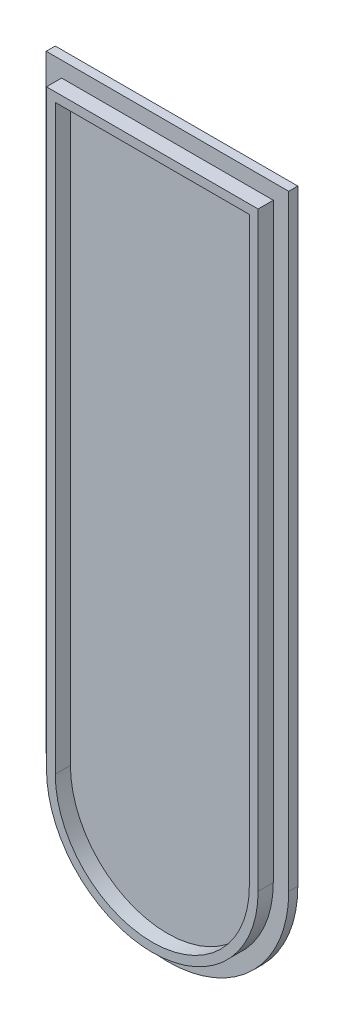
from build123d import *

# Parameters (mm, degrees)
RESSALTO_EXTRUS_O1_DEPTH = 3
RESSALTO_EXTRUS_O2_DEPTH = 5


with BuildPart() as part:
    # Esboço1 → Ressalto-extrusão1 (new body)
    with BuildSketch(Plane.XY):
        with BuildLine():
            Line((-40, 0), (-40, 200))
            Line((-40, 200), (40, 200))
            Line((40, 200), (40, 0))
            ThreePointArc((40, 0), (0, -40), (-40, 0))
        make_face()
    extrude(amount=RESSALTO_EXTRUS_O1_DEPTH)

    # Esboço2 → Ressalto-extrusão2 (add)
    with BuildSketch(Plane.XY.offset(3)):
        with BuildLine():
            Line((-34.9, 0), (-34.9, 194.9))
            Line((-34.9, 194.9), (34.9, 194.9))
            Line((34.9, 194.9), (34.9, 0))
            ThreePointArc((34.9, 0), (0, -34.9), (-34.9, 0))
        make_face()
        with BuildLine():
            Line((32, 0), (32, 191.9))
            Line((32, 191.9), (-32, 191.9))
            Line((-32, 191.9), (-32, 0))
            ThreePointArc((-32, 0), (0, -32), (32, 0))
        make_face(mode=Mode.SUBTRACT)
    extrude(amount=RESSALTO_EXTRUS_O2_DEPTH)


solid = part.part
